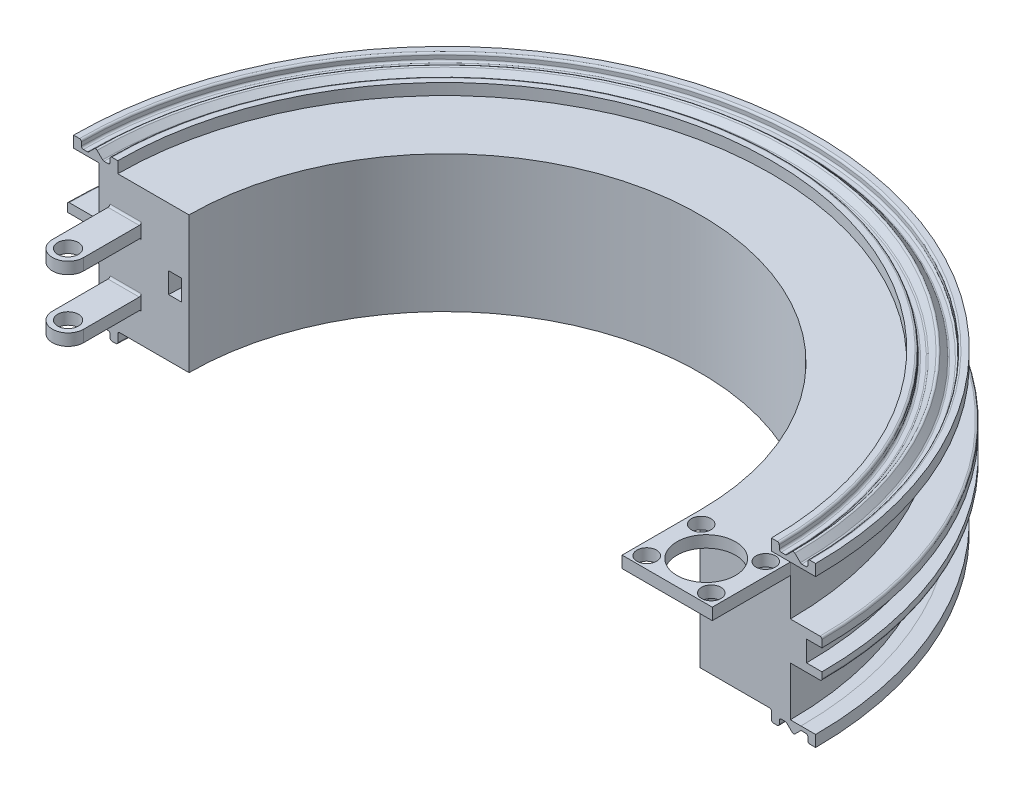
from build123d import *

# Parameters (mm, degrees)
SKETCH1_W           = 3.3
SKETCH1_H           = 5.3
SKETCH13_W          = 8
SKETCH13_H          = 3
BOSS_EXTRUDE1_DEPTH = 1
SKETCH15_R          = 2.65
BOSS_EXTRUDE4_DEPTH = 3
SKETCH17_W          = 23.090911996
SKETCH17_H          = 3
BOSS_EXTRUDE5_DEPTH = 20
SKETCH18_R          = 7.5
SKETCH18_R_2        = 2.5
CUT_EXTRUDE1_DEPTH  = 4
FILLET1_R           = 0.5
FILLET2_R           = 0.5
FILLET3_R           = 0.5
FILLET4_R           = 0.5
FILLET5_R           = 0.5
FILLET6_R           = 0.5
FILLET7_R           = 0.5
FILLET8_R           = 0.5
FILLET9_R           = 0.5
FILLET10_R          = 0.5


with BuildPart() as part:
    # Sweep3: sweep along a path in Sketch3
    with BuildLine(Plane(origin=(0, 0, 0), x_dir=(1, 0, 0), z_dir=(0, 1, 0))) as sweep3_path:
        ThreePointArc((0, 0), (65.459977148, 65.459977148), (130.919954296, 0))
    # Sketch1 → Sweep3 (sweep)
    with BuildSketch(Plane.XY):
        Polygon((0, 22.142579535), (0, -12.857420465), (-18.25, -12.857420465), (-18.25, -15.766608775), (-20.25, -15.766608775), (-20.25, -13.857420465), (-22, -13.857420465), (-23.909188309, -15.766608775), (-25.818376618, -13.857420465), (-27.568376618, -13.857420465), (-27.568376618, -15.766608775), (-29.568376618, -15.766608775), (-29.568376618, -12.857420465), (-25.818376618, -12.857420465), (-23.090911996, -12.857420465), (-23.090911996, -0.233497298), (-31.18925866, -0.233497298), (-31.18925866, 1.842580104), (-27.242461746, 1.842580104), (-27.244919378, 7.142579535), (-31.18925866, 7.142579535), (-31.18925866, 9.518656368), (-23.090911996, 9.518656368), (-23.090911996, 22.142579535), (-25.818376618, 22.142579535), (-29.568376618, 22.142579535), (-29.568376618, 25.051767844), (-27.568376618, 25.051767844), (-27.568376618, 23.142579535), (-25.818376618, 23.142579535), (-23.909188309, 25.051767844), (-22, 23.142579535), (-20.25, 23.142579535), (-20.25, 25.051767844), (-18.25, 25.051767844), (-18.25, 22.142579535), align=None)
        with Locations((-3.594919378, 4.492579535)):
            Rectangle(SKETCH1_W, SKETCH1_H, mode=Mode.SUBTRACT)
    sweep(path=sweep3_path.line)

    # Sketch13 → Boss-Extrude1 (add)
    with BuildSketch(Plane.XY):
        with Locations((-16.244919378, 12.44257982)):
            Rectangle(SKETCH13_W, SKETCH13_H)
        with Locations((-16.244919378, -3.45742018)):
            Rectangle(SKETCH13_W, SKETCH13_H)
    boss_extrude1 = extrude(amount=BOSS_EXTRUDE1_DEPTH)

    # Sketch15 → Boss-Extrude4 (add)
    with BuildSketch(Plane(origin=(0, 13.94257982, 0), x_dir=(1, 0, 0), z_dir=(0, 1, 0))):
        with BuildLine():
            Line((-20.244919378, -1), (-20.244919378, -14.744066262))
            ThreePointArc((-20.244919378, -14.744066262), (-16.244919378, -18.744066262), (-12.244919378, -14.744066262))
            Line((-12.244919378, -14.744066262), (-12.244919378, -1))
            Line((-12.244919378, -1), (-20.244919378, -1))
        make_face()
        with Locations((-16.244919378, -14.744066262)):
            Circle(SKETCH15_R, mode=Mode.SUBTRACT)
    boss_extrude4 = extrude(amount=-BOSS_EXTRUDE4_DEPTH)

    # Mirror3: Boss-Extrude1, Boss-Extrude4 across plane
    add(boss_extrude1.mirror(Plane.ZX.offset(4.49257982)))
    add(boss_extrude4.mirror(Plane.ZX.offset(4.49257982)))

    # Sketch17 → Boss-Extrude5 (add)
    with BuildSketch(Plane.XY):
        with Locations((142.465410294, 20.642579535)):
            Rectangle(SKETCH17_W, SKETCH17_H)
    extrude(amount=BOSS_EXTRUDE5_DEPTH)

    # Sketch18 → Cut-Extrude1 (cut)
    with BuildSketch(Plane.XZ.offset(-19.142579535)):
        with Locations((142.465410294, 10)):
            Circle(SKETCH18_R)
        with Locations((134.201832323, 16.974110273)):
            Circle(SKETCH18_R_2)
        with Locations((150.728988265, 16.974110273)):
            Circle(SKETCH18_R_2)
        with Locations((134.201832323, 3.025889727)):
            Circle(SKETCH18_R_2)
        with Locations((150.728988265, 3.025889727)):
            Circle(SKETCH18_R_2)
    extrude(amount=-CUT_EXTRUDE1_DEPTH, mode=Mode.SUBTRACT)

    # Fillet1
    fillet1_edges = [part.edges().sort_by_distance(p)[0] for p in [
        (65.459977148, 25.051767844, -89.369165457),
    ]]
    fillet(fillet1_edges, radius=FILLET1_R)

    # Fillet2
    fillet2_edges = [part.edges().sort_by_distance(p)[0] for p in [
        (65.459977148, 23.142579535, -91.278353766),
    ]]
    fillet(fillet2_edges, radius=FILLET2_R)

    # Fillet3
    fillet3_edges = [part.edges().sort_by_distance(p)[0] for p in [
        (65.459977148, 23.142579535, -93.028353766),
    ]]
    fillet(fillet3_edges, radius=FILLET3_R)

    # Fillet4
    fillet4_edges = [part.edges().sort_by_distance(p)[0] for p in [
        (65.459977148, 23.142579535, -85.709977148),
        (65.459977148, 23.142579535, -87.459977148),
    ]]
    fillet(fillet4_edges, radius=FILLET4_R)

    # Fillet5
    fillet5_edges = [part.edges().sort_by_distance(p)[0] for p in [
        (65.459977148, -15.766608775, -85.709977148),
        (65.459977148, -13.857420465, -87.459977148),
        (65.459977148, -15.766608775, -89.369165457),
    ]]
    fillet(fillet5_edges, radius=FILLET5_R)

    # Fillet6
    fillet6_edges = [part.edges().sort_by_distance(p)[0] for p in [
        (65.459977148, -12.857420465, -83.709977148),
        (65.459977148, -15.766608775, -83.709977148),
        (65.459977148, -13.857420465, -85.709977148),
    ]]
    fillet(fillet6_edges, radius=FILLET6_R)

    # Fillet7
    fillet7_edges = [part.edges().sort_by_distance(p)[0] for p in [
        (65.459977148, -13.857420465, -91.278353766),
        (65.459977148, -15.766608775, -93.028353766),
        (65.459977148, -13.857420465, -93.028353766),
    ]]
    fillet(fillet7_edges, radius=FILLET7_R)

    # Fillet8
    fillet8_edges = [part.edges().sort_by_distance(p)[0] for p in [
        (-16.244919378, 13.94257982, 0),
        (-16.244919378, -4.95742018, 0),
        (-16.244919378, 10.94257982, 0),
        (-16.244919378, -1.95742018, 0),
    ]]
    fillet(fillet8_edges, radius=FILLET8_R)

    # Fillet9
    fillet9_edges = [part.edges().sort_by_distance(p)[0] for p in [
        (65.459977148, -0.233497298, -96.649235808),
        (65.459977148, 9.518656368, -96.649235808),
    ]]
    fillet(fillet9_edges, radius=FILLET9_R)

    # Fillet10
    fillet10_edges = [part.edges().sort_by_distance(p)[0] for p in [
        (65.459977148, 25.051767844, -93.028353766),
        (65.459977148, 25.051767844, -85.709977148),
    ]]
    fillet(fillet10_edges, radius=FILLET10_R)


solid = part.part
